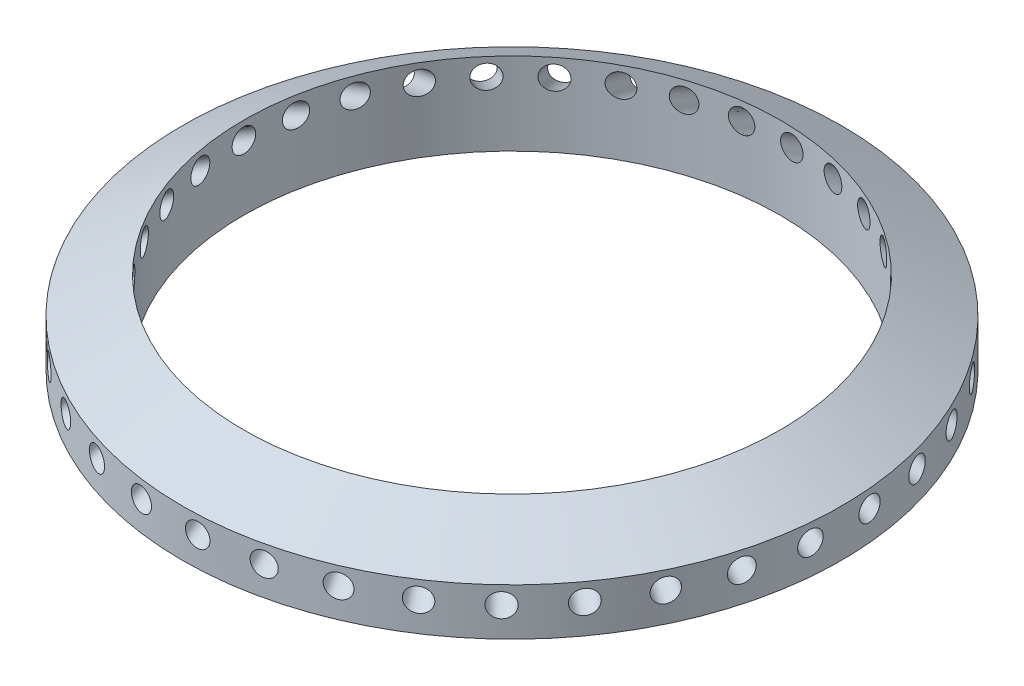
from build123d import *

# Parameters (mm, degrees)
CROQUIS2_R            = 1
CORTAR_EXTRUIR1_DEPTH = 10
MATRIZC1_COUNT        = 35
CROQUIS3_R            = 1.8
CORTAR_EXTRUIR2_DEPTH = 3.5


with BuildPart() as part:
    # Croquis1 → Revolución1 (revolve)
    with BuildSketch(Plane.XY):
        Polygon((-22.8, 0), (-28, 0), (-28, 1), (-28, 4), (-22.8, 7.0022214), align=None)
    revolve(axis=Axis((0, 0, 0), (0, 1, 0)))

    # Croquis2 → Cortar-Extruir1 (cut, along a direction that is not the sketch's normal)
    with BuildSketch(Plane.ZY.offset(28)):
        with Locations((0, 2.5)):
            Circle(CROQUIS2_R)
    cortar_extruir1 = extrude(amount=-CORTAR_EXTRUIR1_DEPTH, dir=(-0.8660254037844377, -0.5000000000000018, 0), mode=Mode.SUBTRACT)

    # MatrizC1: Cortar-Extruir1 ×35 about axis
    matrizc1_axis = Axis((0, 0, 0), (0, -1, 0))
    for i in range(1, MATRIZC1_COUNT):
        add(cortar_extruir1.rotate(matrizc1_axis, i * 360 / MATRIZC1_COUNT), mode=Mode.SUBTRACT)

    # Croquis3 → Cortar-Extruir2 (cut)
    with BuildSketch(Plane.XZ):
        with Locations((-25.082532104, 2.430346327)):
            Circle(CROQUIS3_R)
        with Locations((2.430346327, 25.082532104)):
            Circle(CROQUIS3_R)
        with Locations((25.082532104, -2.430346327)):
            Circle(CROQUIS3_R)
        with Locations((-2.430346327, -25.082532104)):
            Circle(CROQUIS3_R)
    extrude(amount=-CORTAR_EXTRUIR2_DEPTH, mode=Mode.SUBTRACT)


solid = part.part
